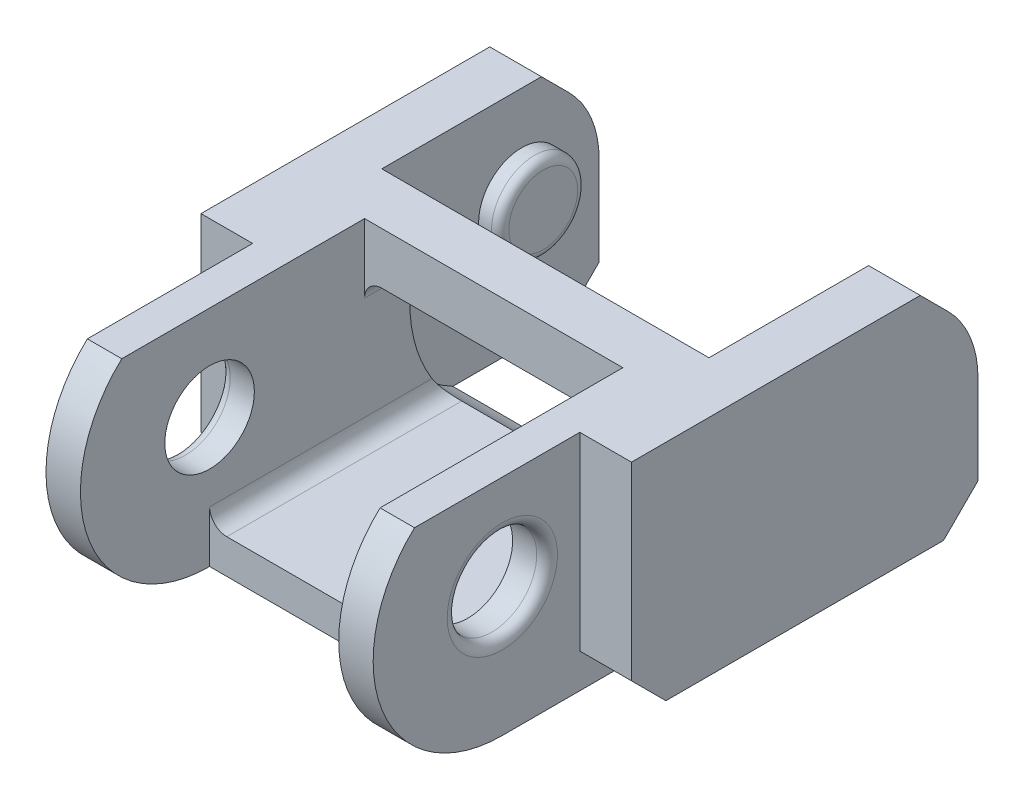
from build123d import *

# Parameters (mm, degrees)
EXTRUDE_1_DEPTH           = 27
CUT_EXTRUDE_1_DEPTH       = 27
SKETCH_3_R                = 2.5000000000000013
EXTRUDE_2_DEPTH           = 2
CUT_EXTRUDE_START         = -2
SKETCH_4_R                = 8.5
SKETCH_4_R_2              = 2.5000000000000018
CUT_EXTRUDE_2_DEPTH       = 2
SKETCH_5_R                = 8.5
CUT_EXTRUDE_3_DEPTH       = 17
SKETCH_9_W                = 19
SKETCH_9_H                = 0.7371254741666728
CUT_EXTRUDE_7_DEPTH       = 4
CUT_EXTRUDE_8_DEPTH       = 0.906172
EXTRUDE_START             = 2
SKETCH_13_R               = 2.5000000000000004
EXTRUDE_4_DEPTH           = 2
SKETCH_14_W               = 3
SKETCH_14_H               = 7.375961595364039
SKETCH_14_W_2             = 2.9999999999999964
CUT_EXTRUDE_10_DEPTH      = 30
CUT_EXTRUDE_11_DEPTH      = 37.95471984311929
CUT_EXTRUDE_11_DEPTH_BACK = 37.95471984311929
FILLET_3_R                = 6
SKETCH_19_W               = 2.3759615953640427
SKETCH_19_H               = 13
CUT_EXTRUDE_13_DEPTH      = 37.95471984311929
SKETCH_18_R               = 7.499999999999999
EXTRUDE_5_DEPTH           = 2
EXTRUDE_START_2           = -2
SKETCH_20_R               = 7.499999999999999
EXTRUDE_6_DEPTH           = 2
SKETCH_21_W               = 27.916060476025446
SKETCH_21_H               = 6.853449812850004
CUT_EXTRUDE_14_DEPTH      = 44.16278511667507
CUT_EXTRUDE_15_DEPTH      = 41.84856377041868
CUT_EXTRUDE_15_DEPTH_BACK = 41.84856377041868
SKETCH_22_R               = 2.5999999999999996
FILLET_4_R                = 0.6
FILLET_5_R                = 0.6
FILLET_6_R                = 1
FILLET_7_R                = 0.5
SKETCH_23_R               = 2.5000000000000004
CUT_EXTRUDE_16_DEPTH      = 0.75
CUT_EXTRUDE_START_2       = -0.75
SKETCH_25_R               = 2.5000000000000013
CUT_EXTRUDE_17_DEPTH      = 0.75
FILLET_8_R                = 0.5
SKETCH_27_W               = 15
SKETCH_27_H               = 4.175939890720404
CUT_EXTRUDE_18_DEPTH      = 4
EXTRUDE_8_DEPTH           = 5
FILLET_9_R                = 1
SKETCH_29_W               = 2.9999999999999964
SKETCH_29_H               = 12.999999999999996
SKETCH_29_W_2             = 3
EXTRUDE_9_DEPTH           = 0.5
CHAMFER_1_SIZE            = 2


with BuildPart() as part:
    # 草圖1 → 填料-伸長1 (new body)
    with BuildSketch(Plane.XY):
        Polygon((-1.8124414345344562, 12.355214230576285), (23.187558565465547, 12.355214230576285), (23.187558565465547, -0.6447857694237141), (-1.8124414345344548, -0.6447857694237142), align=None)
        Polygon((3.1875585654655443, 9.355214230576284), (18.187558565465544, 9.355214230576284), (18.187558565465544, 1.355214230576286), (3.187558565465545, 1.355214230576286), align=None, mode=Mode.SUBTRACT)
    extrude(amount=EXTRUDE_1_DEPTH)

    # 草圖2 → 除料-伸長1 (cut)
    with BuildSketch(Plane(origin=(0, 12.355214230576285, 0), x_dir=(1, 0, 0), z_dir=(0, 1, 0))):
        Polygon((1.1875585654655443, 0), (20.187558565465547, 0), (20.187558565465547, -8), (1.1875585654655452, -8), align=None)
    extrude(amount=-CUT_EXTRUDE_1_DEPTH, mode=Mode.SUBTRACT)

    # 草圖3 → 填料-伸長2 (add)
    with BuildSketch(Plane.ZY.offset(-20.187558565465547)):
        with Locations(Location((4.5, 6.855214230576285, 0), (0, 0, 180))):
            Circle(SKETCH_3_R)
    extrude(amount=EXTRUDE_2_DEPTH)

    # 草圖4 → 除料-伸長2 (cut)
    with BuildSketch(Plane.ZY.offset(-18.187558565465547).offset(CUT_EXTRUDE_START)):
        with Locations((4.500000000000004, 6.855214230576285)):
            Circle(SKETCH_4_R)
        with Locations(Location((4.500000000000004, 6.855214230576285, 0), (0, 0, 180))):
            Circle(SKETCH_4_R_2, mode=Mode.SUBTRACT)
    extrude(amount=CUT_EXTRUDE_2_DEPTH, mode=Mode.SUBTRACT)

    # 草圖5 → 除料-伸長3 (cut)
    with BuildSketch(Plane.ZY.offset(-18.187558565465547)):
        with Locations((4.500000000000004, 6.855214230576285)):
            Circle(SKETCH_5_R)
    extrude(amount=CUT_EXTRUDE_3_DEPTH, mode=Mode.SUBTRACT)

    # 草圖9 → 除料-伸長7 (cut)
    with BuildSketch(Plane(origin=(0, 12.355214230576285, 0), x_dir=(1, 0, 0), z_dir=(0, 1, 0))):
        with Locations((10.687558565465551, -11.349303435491194)):
            Rectangle(SKETCH_9_W, SKETCH_9_H)
    extrude(amount=-CUT_EXTRUDE_7_DEPTH, mode=Mode.SUBTRACT)

    # 草圖10 → 除料-伸長8 (cut)
    with BuildSketch(Plane(origin=(0, 0, 11.717866172574531), x_dir=(-1, 0, 0), z_dir=(0, 0, -1))):
        Polygon((-20.18755856546555, 12.355214230576285), (-1.1875585654655494, 12.355214230576285), (-1.1875585654655487, 9.355214230576284), (-20.18755856546555, 9.355214230576284), align=None)
    extrude(amount=-CUT_EXTRUDE_8_DEPTH, mode=Mode.SUBTRACT)

    # 草圖13 → 填料-伸長4 (add)
    with BuildSketch(Plane(origin=(1.1875585654655443, 0, -1.3e-16), x_dir=(-1.1e-16, 0, -1), z_dir=(1, 0, -1.1e-16)).offset(EXTRUDE_START)):
        with Locations((-4.5, 6.855214230576285)):
            Circle(SKETCH_13_R)
    extrude(amount=-EXTRUDE_4_DEPTH)

    # 草圖14 → 除料-伸長10 (cut)
    with BuildSketch(Plane(origin=(0, 12.355214230576285, 0), x_dir=(1, 0, 0), z_dir=(0, 1, 0))):
        with Locations((-0.31244143453445605, -23.312019202317984)):
            Rectangle(SKETCH_14_W, SKETCH_14_H)
        with Locations((21.687558565465544, -23.312019202317984)):
            Rectangle(SKETCH_14_W_2, SKETCH_14_H)
        Polygon((3.1875585654655425, -27), (18.187558565465547, -27), (18.187558565465547, -19.624038404635964), (3.1875585654655443, -19.624038404635964), align=None)
    extrude(amount=-CUT_EXTRUDE_10_DEPTH, mode=Mode.SUBTRACT)

    # 草圖15 → 除料-伸長11 (cut, two sides: drawn at the far end of the back side and taken through both)
    with BuildSketch(Plane.ZY.offset(-20.187558565465547).offset(-CUT_EXTRUDE_11_DEPTH_BACK)):
        Polygon((0, 9.00201797372982), (3.3531962568464273, 12.355214230576285), (0, 12.355214230576285), align=None)
    extrude(amount=CUT_EXTRUDE_11_DEPTH + CUT_EXTRUDE_11_DEPTH_BACK, mode=Mode.SUBTRACT)

    # 圓角3
    fillet_3_edges = [part.edges().sort_by_distance(p)[0] for p in [
        (-0.31244143453445616, 9.00201797372982, 0),
        (21.687558565465547, 9.00201797372982, 0),
    ]]
    fillet(fillet_3_edges, radius=FILLET_3_R)

    # 草圖19 → 除料-伸長13 (cut, through all)
    with BuildSketch(Plane.ZY.offset(-1.187558565465544)):
        with Locations((25.812019202317984, 5.855214230576285)):
            Rectangle(SKETCH_19_W, SKETCH_19_H)
    extrude(amount=-CUT_EXTRUDE_13_DEPTH, mode=Mode.SUBTRACT)

    # 草圖18 → 填料-伸長5 (add)
    with BuildSketch(Plane(origin=(20.187558565465547, 0, 0), x_dir=(0, 0, -1), z_dir=(1, 0, 0))):
        with Locations((-24.624038404635964, 6.855214230576285)):
            Circle(SKETCH_18_R)
    extrude(amount=-EXTRUDE_5_DEPTH)

    # 草圖20 → 填料-伸長6 (add)
    with BuildSketch(Plane.ZY.offset(-1.187558565465544).offset(EXTRUDE_START_2)):
        with Locations((24.624038404635964, 6.855214230576285)):
            Circle(SKETCH_20_R)
    extrude(amount=EXTRUDE_6_DEPTH)

    # 草圖21 → 除料-伸長14 (cut, through all)
    with BuildSketch(Plane(origin=(23.187558565465547, 0, 0), x_dir=(0, 0, -1), z_dir=(1, 0, 0))):
        with Locations((-28.1917606773101, 15.781939137001288)):
            Rectangle(SKETCH_21_W, SKETCH_21_H)
    extrude(amount=-CUT_EXTRUDE_14_DEPTH, mode=Mode.SUBTRACT)

    # 草圖22 → 除料-伸長15 (cut, two sides: drawn at the far end of the back side and taken through both)
    with BuildSketch(Plane(origin=(20.187558565465547, 0, 0), x_dir=(0, 0, -1), z_dir=(1, 0, 0)).offset(-CUT_EXTRUDE_15_DEPTH_BACK)):
        with Locations((-24.624038404635964, 6.8552142305762835)):
            Circle(SKETCH_22_R)
    extrude(amount=CUT_EXTRUDE_15_DEPTH + CUT_EXTRUDE_15_DEPTH_BACK, mode=Mode.SUBTRACT)

    # 圓角4
    fillet_4_edges = [part.edges().sort_by_distance(p)[0] for p in [
        (20.187558565465547, 6.855214230576285, 27.224038404635962),
    ]]
    fillet(fillet_4_edges, radius=FILLET_4_R)

    # 圓角5
    fillet_5_edges = [part.edges().sort_by_distance(p)[0] for p in [
        (1.1875585654655438, 6.855214230576285, 27.224038404635962),
    ]]
    fillet(fillet_5_edges, radius=FILLET_5_R)

    # 圓角6
    # the kernel refuses this fillet: 1 mm, written as the material it adds along each edge
    with BuildSketch(Plane(origin=(18.187558565465544, 9.355214230576284, 19.624038404635964), x_dir=(3.55e-15, -1, 1.066e-14), z_dir=(5.1e-16, -1.066e-14, -1))) as fillet_6_piece_1_section:
        with BuildLine():
            CenterArc((FILLET_6_R, FILLET_6_R), FILLET_6_R, 180, 90.00000000000023)
            Line((-3.55e-15, FILLET_6_R), (0, 0))
            Line((0, 0), (FILLET_6_R, 0))
        make_face()
    fillet_6_piece_1 = extrude(amount=9.499999999999957, mode=Mode.PRIVATE)
    fillet_6_piece_1 = split(fillet_6_piece_1, bisect_by=Plane(origin=(17.960107802534193, 9.130564344096692, 12.624038172574531), z_dir=(0, 0, 1)), keep=Keep.TOP, mode=Mode.PRIVATE)
    fillet_6_piece_1 = fillet_6_piece_1 - Plane(origin=(17.96010780253419, 6.855214230576285, 4.5), x_dir=(2.4e-16, 0, 1), z_dir=(1, 0, -2.4e-16)) * Cylinder(8.5, 23, mode=Mode.PRIVATE)
    add(fillet_6_piece_1)
    with BuildSketch(Plane(origin=(3.187558565465544, 9.355214230576284, 10.124038404635964), x_dir=(0, -1, 0), z_dir=(0, 0, 1))) as fillet_6_piece_2_section:
        with BuildLine():
            CenterArc((FILLET_6_R, FILLET_6_R), FILLET_6_R, 180, 90)
            Line((0, FILLET_6_R), (0, 0))
            Line((0, 0), (FILLET_6_R, 0))
        make_face()
    fillet_6_piece_2 = extrude(amount=9.5, mode=Mode.PRIVATE)
    fillet_6_piece_2 = split(fillet_6_piece_2, bisect_by=Plane(origin=(3.4150094343401456, 9.130564406809754, 12.624038172574531), z_dir=(0, 0, 1)), keep=Keep.TOP, mode=Mode.PRIVATE)
    fillet_6_piece_2 = fillet_6_piece_2 - Plane(origin=(3.415009434340142, 6.855214230576285, 4.5000000000000036), x_dir=(2.4e-16, 0, 1), z_dir=(1, 0, -2.4e-16)) * Cylinder(8.5, 23, mode=Mode.PRIVATE)
    add(fillet_6_piece_2)

    # 圓角7
    fillet_7_edges = [part.edges().sort_by_distance(p)[0] for p in [
        (10.687558565465999, 9.355214230576284, 19.624038404635964),
        (3.4804517842794525, 9.062321011762547, 19.624038404636),
        (17.894665346652545, 9.062321011762547, 19.624038404636),
    ]]
    fillet(fillet_7_edges, radius=FILLET_7_R)

    # 草圖23 → 除料-伸長16 (cut)
    with BuildSketch(Plane(origin=(3.1875585654655443, 0, -3.5e-16), x_dir=(-1.1e-16, 0, -1), z_dir=(1, 0, -1.1e-16))):
        with Locations(Location((-4.5, 6.855214230576285, 0), (0, 0, 180))):
            Circle(SKETCH_23_R)
    extrude(amount=-CUT_EXTRUDE_16_DEPTH, mode=Mode.SUBTRACT)

    # 草圖25 → 除料-伸長17 (cut)
    with BuildSketch(Plane.ZY.offset(-18.187558565465547).offset(CUT_EXTRUDE_START_2)):
        with Locations(Location((4.500000000000004, 6.855214230576285, 0), (0, 0, 180))):
            Circle(SKETCH_25_R)
    extrude(amount=CUT_EXTRUDE_17_DEPTH, mode=Mode.SUBTRACT)

    # 圓角8
    fillet_8_edges = [part.edges().sort_by_distance(p)[0] for p in [
        (2.437558565465545, 6.855214230576286, 7),
        (18.937558565465547, 6.855214230576284, 7.000000000000001),
    ]]
    fillet(fillet_8_edges, radius=FILLET_8_R)

    # 草圖27 → 除料-伸長18 (cut)
    with BuildSketch(Plane.XY.offset(19.624038404635964)):
        with Locations((10.687558565465544, 10.267244285216083)):
            Rectangle(SKETCH_27_W, SKETCH_27_H)
    extrude(amount=-CUT_EXTRUDE_18_DEPTH, mode=Mode.SUBTRACT)

    # 草圖28 → 填料-伸長8 (add)
    with BuildSketch(Plane.XY.offset(19.624038404635964)):
        Polygon((18.187558565465547, -0.6447857694237141), (3.1875585654655443, -0.6447857694237141), (3.1875585654655434, 1.355214230576286), (18.187558565465547, 1.3552142305762875), align=None)
    extrude(amount=EXTRUDE_8_DEPTH)

    # 圓角9
    fillet_9_edges = [part.edges().sort_by_distance(p)[0] for p in [
        (18.187558565465544, 1.3552142305762809, 17.8023895515219),
        (3.1875585654655443, 1.355214230576286, 17.802389551521912),
    ]]
    fillet(fillet_9_edges, radius=FILLET_9_R)

    # 草圖29 → 填料-伸長9 (add)
    with BuildSketch(Plane.XY.offset(19.624038404635964)):
        with Locations((21.687558565465544, 5.8552142305762835)):
            Rectangle(SKETCH_29_W, SKETCH_29_H)
        with Locations((-0.31244143453445605, 5.8552142305762835)):
            Rectangle(SKETCH_29_W_2, SKETCH_29_H)
    extrude(amount=EXTRUDE_9_DEPTH)

    # 導角1
    chamfer_1_edges = [part.edges().sort_by_distance(p)[0] for p in [
        (21.687558565465547, -0.6447857694237141, 0),
        (21.687558565465547, -0.6447857694237141, 20.124038404635964),
        (-0.31244143453445616, -0.6447857694237141, 20.124038404635964),
        (-0.31244143453445616, -0.6447857694237142, 0),
    ]]
    chamfer(chamfer_1_edges, length=CHAMFER_1_SIZE)


solid = part.part
